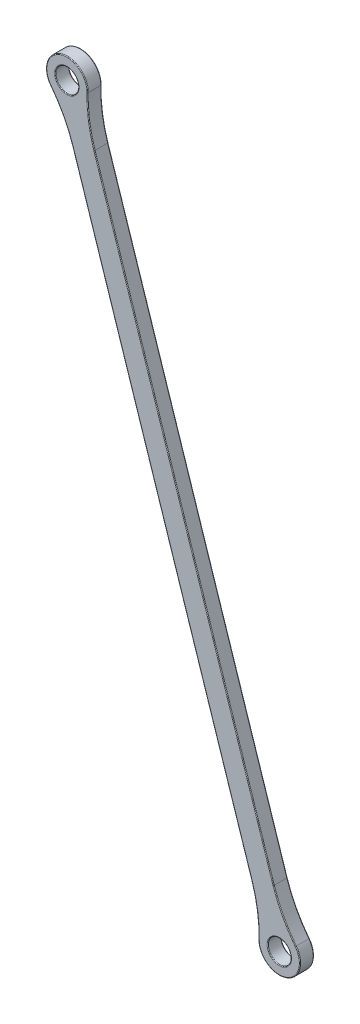
from build123d import *

# Parameters (mm, degrees)
SKETCH1_R           = 2.5
BOSS_EXTRUDE1_DEPTH = 3
FILLET1_R           = 30
FILLET2_R           = 0.15


with BuildPart() as part:
    # Sketch1 → Boss-Extrude1 (new body)
    with BuildSketch(Plane.XY):
        with BuildLine():
            ThreePointArc((-28.046097272, 219.364241268), (-32.988233742, 226.41762369), (-32.79749477, 217.807249998))
            Line((-32.79749477, 217.807249998), (10.959155673, 84.277124674))
            ThreePointArc((10.959155673, 84.277124674), (15.901292143, 77.223742252), (15.710553172, 85.834115944))
            Line((15.710553172, 85.834115944), (-28.046097272, 219.364241268))
        make_face()
        with Locations((-31.586941599, 222.141365942)):
            Circle(SKETCH1_R, mode=Mode.SUBTRACT)
        with Locations((14.5, 81.5)):
            Circle(SKETCH1_R, mode=Mode.SUBTRACT)
    extrude(amount=-BOSS_EXTRUDE1_DEPTH)

    # Fillet1
    fillet1_edges = [part.edges().sort_by_distance(p)[0] for p in [
        (-32.79749477, 217.807249998, -1.5),
        (-28.046097272, 219.364241268, -1.5),
        (10.959155673, 84.277124674, -1.5),
        (15.710553172, 85.834115944, -1.5),
    ]]
    fillet(fillet1_edges, radius=FILLET1_R)

    # Fillet2
    fillet2_edges = [part.edges().sort_by_distance(p)[0] for p in [
        (-34.086941599, 222.141365942, -3),
        (9.693881493, 86.731808966, -3),
        (15.901292143, 77.223742252, -3),
        (15.277685275, 88.561572472, -3),
        (-6.16777205, 152.599178606, -3),
        (-26.780823092, 216.909556976, -3),
        (-32.988233742, 226.41762369, -3),
        (-32.364626874, 215.07979347, -3),
        (-10.919169548, 151.042187336, -3),
        (12, 81.5, -3),
        (-34.086941599, 222.141365942, 0),
        (-26.780823092, 216.909556976, 0),
        (-6.16777205, 152.599178606, 0),
        (15.277685275, 88.561572472, 0),
        (15.901292143, 77.223742252, 0),
        (9.693881493, 86.731808966, 0),
        (-10.919169548, 151.042187336, 0),
        (-32.364626874, 215.07979347, 0),
        (-32.988233742, 226.41762369, 0),
        (12, 81.5, 0),
    ]]
    fillet(fillet2_edges, radius=FILLET2_R)


solid = part.part
